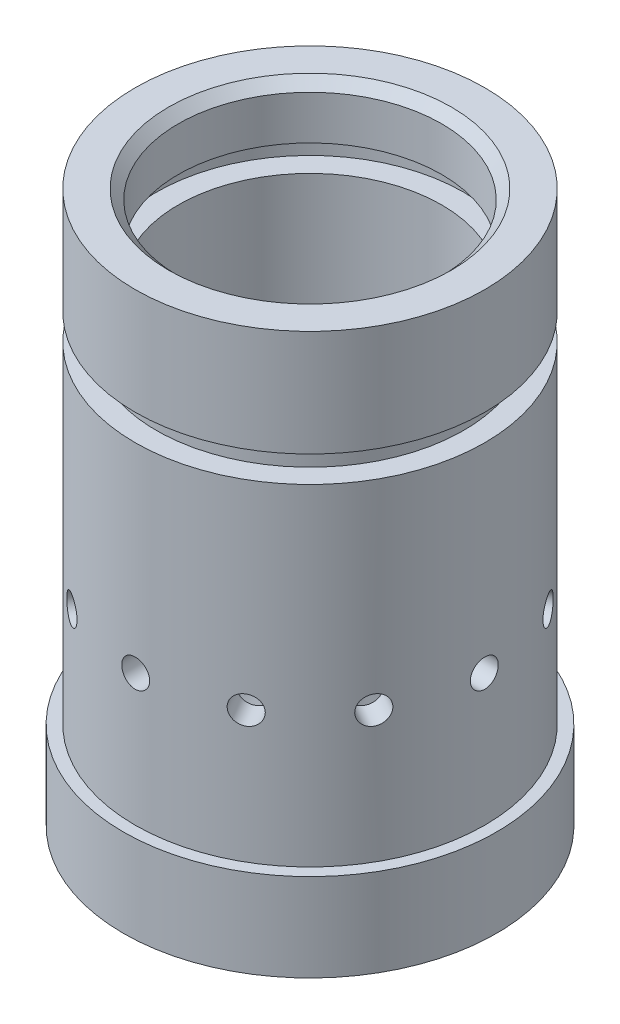
from build123d import *

# Parameters (mm, degrees)
CIRPATTERN1_COUNT = 12


with BuildPart() as part:
    # Sketch1 → Revolve1 (revolve)
    with BuildSketch(Plane.XY):
        Polygon((19.05, -16.651053449), (19.05, -48.147053449), (15.875, -48.147053449), (25.7175, -84.879763523), (26.9875, -84.879763523), (26.9875, -72.179763523), (25.2857, -72.179763523), (25.2857, -24.271053449), (22.225, -24.271053449), (22.225, -20.461053449), (25.2857, -20.461053449), (25.2857, -5.094053449), (20.447, -5.094053449), (19.05, -6.491053449), (19.05, -12.841053449), (22.225, -12.841053449), (22.225, -16.651053449), align=None)
    revolve(axis=Axis((0, 0, 0), (0, 1, 0)))

    # Sketch3 → #10-32 Tapped Hole1 (revolve, cut)
    with BuildSketch(Plane(origin=(0, -53.129763523, -25.2857), x_dir=(0, 1, 0), z_dir=(1, 0, 0))):
        Polygon((0, 0), (0, 4.166057072), (2.0193, 3.81), (2.0193, 0), align=None)
    f_10_32_tapped_hole1 = revolve(axis=Axis((0, -53.129763523, -31.6357), (0, 0, 1)), mode=Mode.SUBTRACT)

    # CirPattern1: #10-32 Tapped Hole1 ×12 about axis
    cirpattern1_axis = Axis((0, 0, 0), (0, -1, 0))
    for i in range(1, CIRPATTERN1_COUNT):
        add(f_10_32_tapped_hole1.rotate(cirpattern1_axis, i * 360 / CIRPATTERN1_COUNT), mode=Mode.SUBTRACT)


solid = part.part
